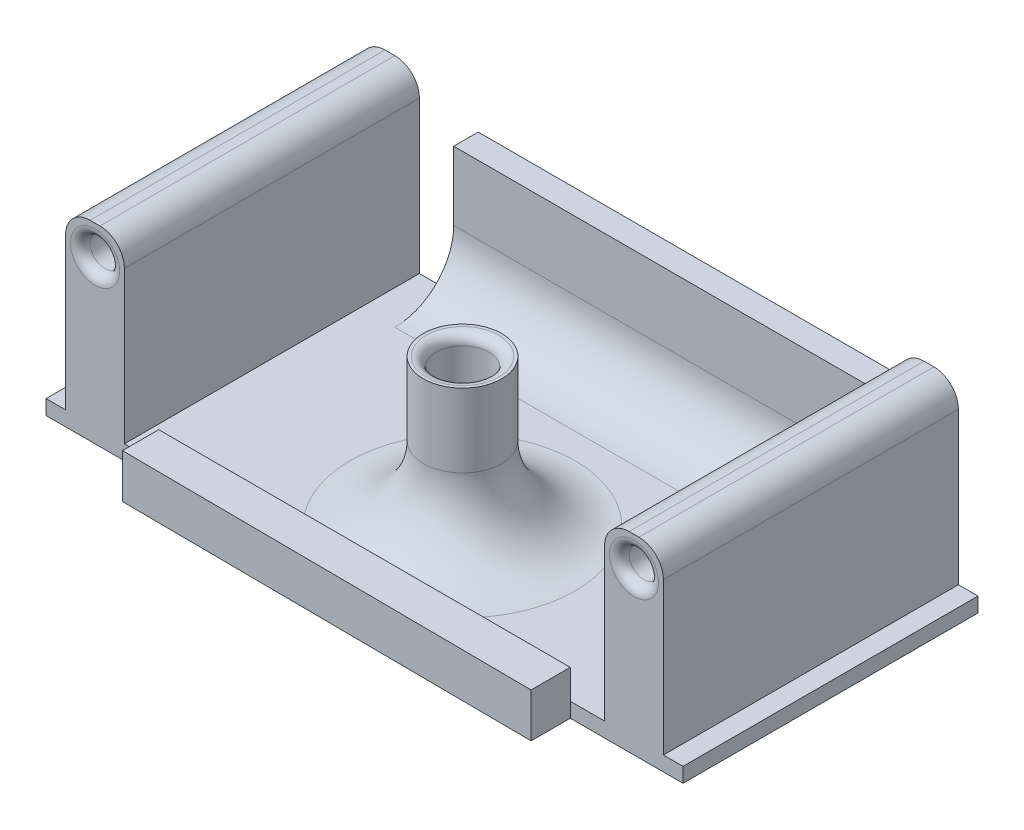
from build123d import *

# Parameters (mm, degrees)
SKETCH_1_W          = 130
SKETCH_1_H          = 60.2
EXTRUDE_1_DEPTH     = 4
SKETCH_2_W          = 12
SKETCH_2_H          = 60.2
EXTRUDE_2_DEPTH     = 36
SKETCH_4_R          = 3
CUT_EXTRUDE_1_DEPTH = 98.206172644
FILLET_1_R          = 5
SKETCH_5_R          = 8
EXTRUDE_3_DEPTH     = 30
SKETCH_6_R          = 5.4
CUT_EXTRUDE_2_DEPTH = 80.290667799
FILLET_3_R          = 2
SKETCH_8_W          = 84
SKETCH_8_H          = 5
EXTRUDE_4_DEPTH     = 30
EXTRUDE_5_DEPTH     = 10
CHAMFER_2_SIZE      = 1
FILLET_5_R          = 2
FILLET_6_R          = 12
FILLET_2_R          = 15


with BuildPart() as part:
    # Эскиз1 → Бобышка-Вытянуть1 (new body)
    with BuildSketch(Plane(origin=(0, 0, 0), x_dir=(1, 0, 0), z_dir=(0, 1, 0))):
        Rectangle(SKETCH_1_W, SKETCH_1_H)
    extrude(amount=EXTRUDE_1_DEPTH)

    # Эскиз2 → Бобышка-Вытянуть2 (add)
    with BuildSketch(Plane(origin=(0, 4, 0), x_dir=(1, 0, 0), z_dir=(0, 1, 0))):
        with Locations((-55, 0)):
            Rectangle(SKETCH_2_W, SKETCH_2_H)
        with Locations((55, 0)):
            Rectangle(SKETCH_2_W, SKETCH_2_H)
    extrude(amount=EXTRUDE_2_DEPTH)

    # Эскиз4 → Вырез-Вытянуть1 (cut, through all)
    with BuildSketch(Plane.XY.offset(30.1)):
        with Locations((-55, 34)):
            Circle(SKETCH_4_R)
        with Locations(Location((55, 34, 0), (0, 0, 180))):
            Circle(SKETCH_4_R)
    extrude(amount=-CUT_EXTRUDE_1_DEPTH, mode=Mode.SUBTRACT)

    # Скругление1
    fillet_1_edges = [part.edges().sort_by_distance(p)[0] for p in [
        (-49, 40, 0),
        (-61, 40, 0),
        (61, 40, 0),
        (49, 40, 0),
    ]]
    fillet(fillet_1_edges, radius=FILLET_1_R)

    # Эскиз5 → Бобышка-Вытянуть3 (add)
    with BuildSketch(Plane(origin=(0, 4, 0), x_dir=(1, 0, 0), z_dir=(0, 1, 0))):
        with Locations(Location((0, -10.1, 0), (0, 0, 90))):
            Circle(SKETCH_5_R)
    extrude(amount=EXTRUDE_3_DEPTH)

    # Эскиз6 → Вырез-Вытянуть2 (cut, through all)
    with BuildSketch(Plane(origin=(0, 34, 0), x_dir=(1, 0, 0), z_dir=(0, 1, 0))):
        with Locations(Location((0, -10.1, 0), (0, 0, 270))):
            Circle(SKETCH_6_R)
    extrude(amount=-CUT_EXTRUDE_2_DEPTH, mode=Mode.SUBTRACT)

    # Скругление3
    fillet_3_edges = [part.edges().sort_by_distance(p)[0] for p in [
        (0, 34, 4.7),
    ]]
    fillet(fillet_3_edges, radius=FILLET_3_R)

    # Эскиз8 → Бобышка-Вытянуть4 (add)
    with BuildSketch(Plane(origin=(0, 0, 0), x_dir=(1, 0, 0), z_dir=(0, 1, 0))):
        with Locations((0, 32.6)):
            Rectangle(SKETCH_8_W, SKETCH_8_H)
    extrude(amount=EXTRUDE_4_DEPTH)

    # Эскиз8<3> → Бобышка-Вытянуть5 (add)
    with BuildSketch(Plane(origin=(0, 0, 0), x_dir=(1, 0, 0), z_dir=(0, 1, 0))):
        Polygon((-42, -30.1), (-42, -37.5), (42, -38.1), (42, -30.1), align=None)
    extrude(amount=EXTRUDE_5_DEPTH)

    # Фаска2
    chamfer_2_edges = [part.edges().sort_by_distance(p)[0] for p in [
        (53.5, 0, 30.1),
        (-42, 0, 33.8),
        (0, 0, 37.8),
        (42, 0, 34.1),
        (-53.5, 0, 30.1),
        (-65, 0, 0),
        (53.5, 0, -30.1),
        (65, 0, 0),
        (0, 0, 4.7),
        (-53.5, 0, -30.1),
        (42, 0, -32.6),
        (-42, 0, -32.6),
        (0, 0, -35.1),
    ]]
    chamfer(chamfer_2_edges, length=CHAMFER_2_SIZE)

    # Скругление5
    fillet_5_edges = [part.edges().sort_by_distance(p)[0] for p in [
        (-58, 34, -30.1),
        (-58, 34, 30.1),
        (58, 34, -30.1),
        (58, 34, 30.1),
    ]]
    fillet(fillet_5_edges, radius=FILLET_5_R)

    # Скругление6
    fillet_6_edges = [part.edges().sort_by_distance(p)[0] for p in [
        (0, 4, -30.1),
    ]]
    fillet(fillet_6_edges, radius=FILLET_6_R)

    # Скругление2
    # the kernel refuses this fillet: 15 mm, written as the material it adds along each edge
    with BuildSketch(Plane(origin=(0, 4, 10.1), x_dir=(0, 0, -1), z_dir=(1, 0, 0))) as fillet_2_piece_1:
        with BuildLine():
            CenterArc((8 + FILLET_2_R, FILLET_2_R), FILLET_2_R, 180, 90)
            Line((8, FILLET_2_R), (8, 0))
            Line((8, 0), (8 + FILLET_2_R, 0))
        make_face()
    revolve(axis=Axis((0, 4, 10.1), (0, 1, 0)))


solid = part.part
